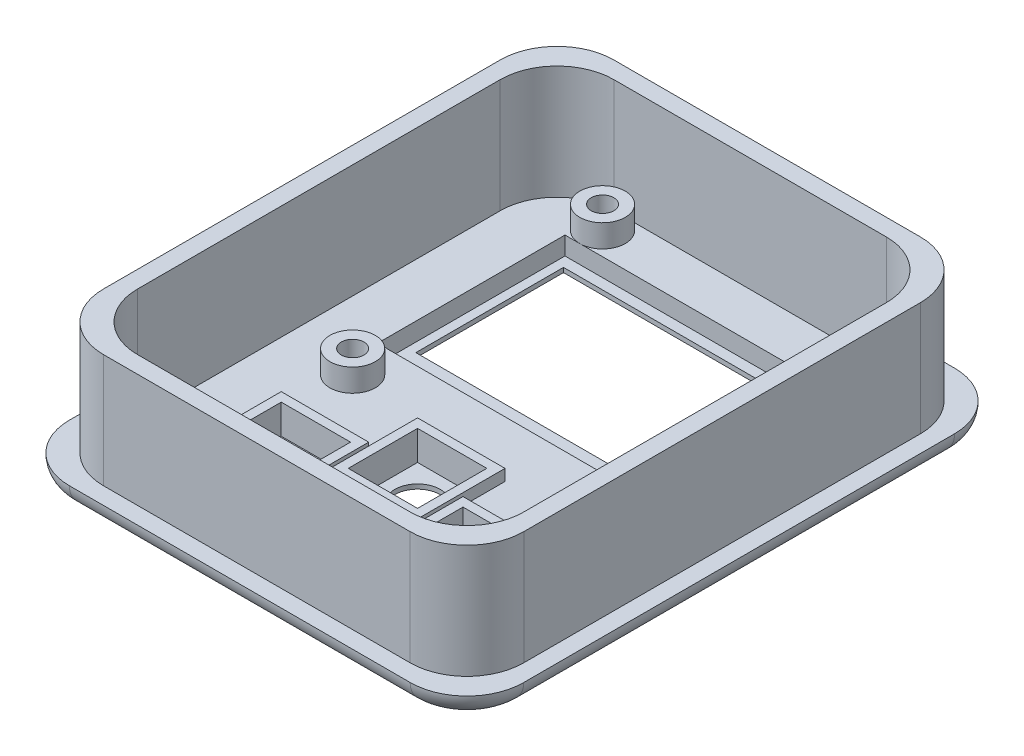
from build123d import *

# Parameters (mm, degrees)
SCHIZZO1_W                     = 40
SCHIZZO1_H                     = 47.93
ESTRUSIONE_ESTRUSIONE1_DEPTH   = 2
SCHIZZO1_3_W                   = 37
SCHIZZO1_3_H                   = 44.93
SCHIZZO1_3_W_2                 = 34
SCHIZZO1_3_H_2                 = 41.93
ESTRUSIONE_ESTRUSIONE2_DEPTH   = 12
RACCORDO1_R                    = 5
RACCORDO2_R                    = 2
TAGLIO_ESTRUSIONE1_DEPTH       = 34.441310157
TAGLIO_ESTRUSIONE1_DEPTH_BACK  = 34.441310157
SCHIZZO2_R                     = 2
SCHIZZO2_W                     = 23
SCHIZZO2_H                     = 13
TAGLIO_ESTRUSIONE2_START       = 0.4
SCHIZZO3_R                     = 0.995847047
SCHIZZO3_R_2                   = 1
SCHIZZO3_W                     = 24.6
SCHIZZO3_H                     = 16.5
TAGLIO_ESTRUSIONE2_DEPTH       = 34.041310157
SCHIZZO3_3_R                   = 2
SCHIZZO3_3_R_2                 = 0.995847047
ESTRUSIONE_ESTRUSIONE3_DEPTH   = 4
SCHIZZO3_3_R_3                 = 1
ESTRUSIONE_ESTRUSIONE3_2_DEPTH = 4
ESTRUSIONE_ESTRUSIONE3_3_DEPTH = 4
ESTRUSIONE_ESTRUSIONE3_4_DEPTH = 4
TAGLIO_ESTRUSIONE3_START       = 0.4
SCHIZZO2_5_W                   = 6.1
SCHIZZO2_5_H                   = 6.1
TAGLIO_ESTRUSIONE3_DEPTH       = 34.041310157
SCHIZZO2_6_W                   = 7.7
SCHIZZO2_6_H                   = 7.7
SCHIZZO2_6_W_2                 = 6.1
SCHIZZO2_6_H_2                 = 6.1
ESTRUSIONE_ESTRUSIONE4_DEPTH   = 3


with BuildPart() as part:
    # Schizzo1 → Estrusione-Estrusione1 (new body)
    with BuildSketch(Plane(origin=(0, 0, 0), x_dir=(1, 0, 0), z_dir=(0, 1, 0))):
        Rectangle(SCHIZZO1_W, SCHIZZO1_H)
    extrude(amount=ESTRUSIONE_ESTRUSIONE1_DEPTH)

    # Schizzo1<3> → Estrusione-Estrusione2 (add)
    with BuildSketch(Plane(origin=(0, 0, 0), x_dir=(1, 0, 0), z_dir=(0, 1, 0))):
        Rectangle(SCHIZZO1_3_W, SCHIZZO1_3_H)
        Rectangle(SCHIZZO1_3_W_2, SCHIZZO1_3_H_2, mode=Mode.SUBTRACT)
    extrude(amount=ESTRUSIONE_ESTRUSIONE2_DEPTH)

    # Raccordo1
    raccordo1_edges = [part.edges().sort_by_distance(p)[0] for p in [
        (18.5, 7, -22.465),
        (-18.5, 7, -22.465),
        (-18.5, 7, 22.465),
        (18.5, 7, 22.465),
        (-17, 7, -20.965),
        (-17, 7, 20.965),
        (17, 7, 20.965),
        (17, 7, -20.965),
        (-20, 1, -23.965),
        (20, 1, -23.965),
        (20, 1, 23.965),
        (-20, 1, 23.965),
    ]]
    fillet(raccordo1_edges, radius=RACCORDO1_R)

    # Raccordo2
    raccordo2_edges = [part.edges().sort_by_distance(p)[0] for p in [
        (18.535533906, 0, -22.500533906),
        (0, 0, -23.965),
        (-18.535533906, 0, -22.500533906),
        (-20, 0, 0),
        (-18.535533906, 0, 22.500533906),
        (0, 0, 23.965),
        (18.535533906, 0, 22.500533906),
        (20, 0, 0),
    ]]
    fillet(raccordo2_edges, radius=RACCORDO2_R - 0.0001)  # a hair under: the kernel refuses the full size

    # Schizzo2 → Taglio-Estrusione1 (cut, two sides: drawn at the far end of the back side and taken through both)
    with BuildSketch(Plane(origin=(0, 0, 0), x_dir=(1, 0, 0), z_dir=(0, 1, 0)).offset(-TAGLIO_ESTRUSIONE1_DEPTH_BACK)):
        with Locations(Location((0, -8.314831285, 0), (0, 0, 270))):
            Circle(SCHIZZO2_R)
        with Locations(Location((8, -12.314831285, 0), (0, 0, 270))):
            Circle(SCHIZZO2_R)
        with Locations(Location((0, -16.314831285, 0), (0, 0, 270))):
            Circle(SCHIZZO2_R)
        with Locations(Location((-8, -12.314831285, 0), (0, 0, 270))):
            Circle(SCHIZZO2_R)
        with Locations((0, 9.532336944)):
            Rectangle(SCHIZZO2_W, SCHIZZO2_H)
    extrude(amount=TAGLIO_ESTRUSIONE1_DEPTH + TAGLIO_ESTRUSIONE1_DEPTH_BACK, mode=Mode.SUBTRACT)

    # Schizzo3 → Taglio-Estrusione2 (cut, through all)
    with BuildSketch(Plane(origin=(0, 0, 0), x_dir=(1, 0, 0), z_dir=(0, 1, 0)).offset(TAGLIO_ESTRUSIONE2_START)):
        with Locations(Location((-10.995, 18.965, 0), (0, 0, 270))):
            Circle(SCHIZZO3_R)
        with Locations(Location((10.995, 18.965, 0), (0, 0, 270))):
            Circle(SCHIZZO3_R_2)
        with Locations((0, 8.715)):
            Rectangle(SCHIZZO3_W, SCHIZZO3_H)
    extrude(amount=TAGLIO_ESTRUSIONE2_DEPTH, mode=Mode.SUBTRACT)

    # Schizzo2<5> → Taglio-Estrusione3 (cut, through all)
    with BuildSketch(Plane(origin=(0, 0, 0), x_dir=(1, 0, 0), z_dir=(0, 1, 0)).offset(TAGLIO_ESTRUSIONE3_START)):
        with Locations((0, -8.314831285)):
            Rectangle(SCHIZZO2_5_W, SCHIZZO2_5_H)
        with Locations((8, -12.314831285)):
            Rectangle(SCHIZZO2_5_W, SCHIZZO2_5_H)
        with Locations((0, -16.314831285)):
            Rectangle(SCHIZZO2_5_W, SCHIZZO2_5_H)
        with Locations((-8, -12.314831285)):
            Rectangle(SCHIZZO2_5_W, SCHIZZO2_5_H)
    extrude(amount=TAGLIO_ESTRUSIONE3_DEPTH, mode=Mode.SUBTRACT)

    # Schizzo2<6> → Estrusione-Estrusione4 (add)
    # profile 1 of 4: a face of its own
    with BuildSketch(Plane(origin=(0, 0, 0), x_dir=(1, 0, 0), z_dir=(0, 1, 0))):
        with Locations((0, -8.314831285)):
            Rectangle(SCHIZZO2_6_W, SCHIZZO2_6_H)
        with Locations((0, -8.314831285)):
            Rectangle(SCHIZZO2_6_W_2, SCHIZZO2_6_H_2, mode=Mode.SUBTRACT)
    # profile 2 of 4: a face of its own
    with BuildSketch(Plane(origin=(0, 0, 0), x_dir=(1, 0, 0), z_dir=(0, 1, 0))):
        with Locations((8, -12.314831285)):
            Rectangle(SCHIZZO2_6_W, SCHIZZO2_6_H)
        with Locations((8, -12.314831285)):
            Rectangle(SCHIZZO2_6_W_2, SCHIZZO2_6_H_2, mode=Mode.SUBTRACT)
    # profile 3 of 4: a face of its own
    with BuildSketch(Plane(origin=(0, 0, 0), x_dir=(1, 0, 0), z_dir=(0, 1, 0))):
        with Locations((0, -16.314831285)):
            Rectangle(SCHIZZO2_6_W, SCHIZZO2_6_H)
        with Locations((0, -16.314831285)):
            Rectangle(SCHIZZO2_6_W_2, SCHIZZO2_6_H_2, mode=Mode.SUBTRACT)
    # profile 4 of 4: a face of its own
    with BuildSketch(Plane(origin=(0, 0, 0), x_dir=(1, 0, 0), z_dir=(0, 1, 0))):
        with Locations((-8, -12.314831285)):
            Rectangle(SCHIZZO2_6_W, SCHIZZO2_6_H)
        with Locations((-8, -12.314831285)):
            Rectangle(SCHIZZO2_6_W_2, SCHIZZO2_6_H_2, mode=Mode.SUBTRACT)
    extrude(amount=ESTRUSIONE_ESTRUSIONE4_DEPTH)


with BuildPart() as body_2:
    # Schizzo3<3> → Estrusione-Estrusione3 (new body)
    with BuildSketch(Plane(origin=(0, 0, 0), x_dir=(1, 0, 0), z_dir=(0, 1, 0))):
        with Locations(Location((-10.995, 18.965, 0), (0, 0, 270))):
            Circle(SCHIZZO3_3_R)
        with Locations(Location((-10.995, 18.965, 0), (0, 0, 270))):
            Circle(SCHIZZO3_3_R_2, mode=Mode.SUBTRACT)
    extrude(amount=ESTRUSIONE_ESTRUSIONE3_DEPTH)


with BuildPart() as body_3:
    # Schizzo3<3> → Estrusione-Estrusione3 2 (new body)
    with BuildSketch(Plane(origin=(0, 0, 0), x_dir=(1, 0, 0), z_dir=(0, 1, 0))):
        with Locations(Location((10.995, 18.965, 0), (0, 0, 270))):
            Circle(SCHIZZO3_3_R)
        with Locations(Location((10.995, 18.965, 0), (0, 0, 270))):
            Circle(SCHIZZO3_3_R_3, mode=Mode.SUBTRACT)
    extrude(amount=ESTRUSIONE_ESTRUSIONE3_2_DEPTH)


with BuildPart() as body_4:
    # Schizzo3<3> → Estrusione-Estrusione3 3 (new body)
    with BuildSketch(Plane(origin=(0, 0, 0), x_dir=(1, 0, 0), z_dir=(0, 1, 0))):
        with Locations(Location((-10.995, -3.035, 0), (0, 0, 270))):
            Circle(SCHIZZO3_3_R)
        with Locations(Location((-10.995, -3.035, 0), (0, 0, 270))):
            Circle(SCHIZZO3_3_R_2, mode=Mode.SUBTRACT)
    extrude(amount=ESTRUSIONE_ESTRUSIONE3_3_DEPTH)


with BuildPart() as body_5:
    # Schizzo3<3> → Estrusione-Estrusione3 4 (new body)
    with BuildSketch(Plane(origin=(0, 0, 0), x_dir=(1, 0, 0), z_dir=(0, 1, 0))):
        with Locations(Location((10.995, -3.035, 0), (0, 0, 270))):
            Circle(SCHIZZO3_3_R)
        with Locations(Location((10.995, -3.035, 0), (0, 0, 270))):
            Circle(SCHIZZO3_3_R_2, mode=Mode.SUBTRACT)
    extrude(amount=ESTRUSIONE_ESTRUSIONE3_4_DEPTH)


solid = Compound([part.part, body_2.part, body_3.part, body_4.part, body_5.part])
